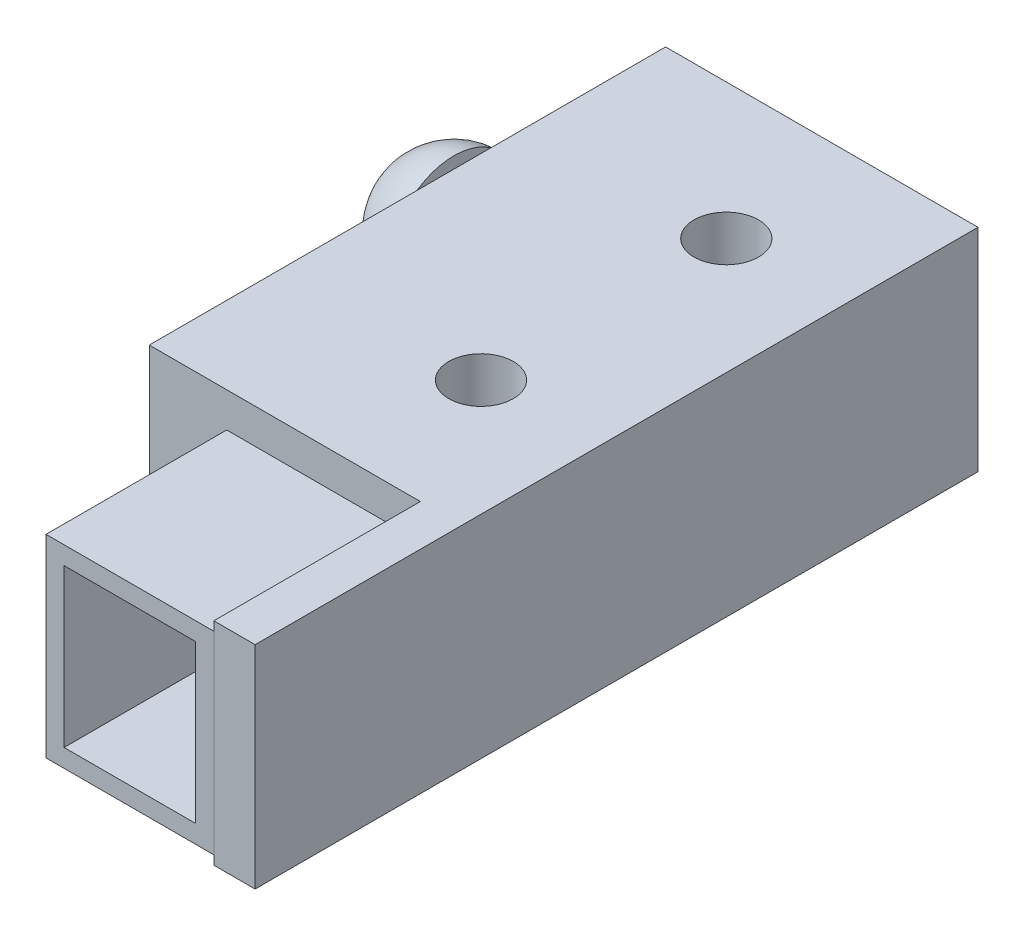
from build123d import *

# Parameters (mm, degrees)
SKETCH_1_W      = 10.5
SKETCH_1_H      = 20
SKETCH_1_R      = 1.25
EXTRUDE_1_DEPTH = 6.5
SKETCH_2_W      = 2
SKETCH_2_H      = 3.5
EXTRUDE_2_DEPTH = 1.2
SKETCH_3_R      = 2.5
EXTRUDE_3_DEPTH = 2.5
FILLET_1_R      = 2.5
SKETCH_4_W      = 28
SKETCH_4_H      = 8.2
EXTRUDE_4_DEPTH = 1.6
SKETCH_5_W      = 7
SKETCH_5_H      = 7.5
EXTRUDE_5_DEPTH = 6.5
SHELL_1_T       = -0.7


with BuildPart() as part:
    # 草图1 → 凸台-拉伸1 (new body)
    with BuildSketch(Plane(origin=(0, 0, 0), x_dir=(1, 0, 0), z_dir=(0, 1, 0))):
        with Locations((-2.35, 0)):
            Rectangle(SKETCH_1_W, SKETCH_1_H)
        with Locations(Location((0, 4.75, 0), (0, 0, 90))):
            Circle(SKETCH_1_R, mode=Mode.SUBTRACT)
        with Locations(Location((0, -4.75, 0), (0, 0, 90))):
            Circle(SKETCH_1_R, mode=Mode.SUBTRACT)
    extrude(amount=EXTRUDE_1_DEPTH)

    # 草图2 → 凸台-拉伸2 (add)
    with BuildSketch(Plane.ZY.offset(7.6)):
        with Locations((-3, 3.25)):
            Rectangle(SKETCH_2_W, SKETCH_2_H)
    extrude(amount=EXTRUDE_2_DEPTH)

    # 草图3 → 凸台-拉伸3 (add)
    with BuildSketch(Plane.ZY.offset(8.8)):
        with Locations((-3, 3.25)):
            Circle(SKETCH_3_R)
    extrude(amount=EXTRUDE_3_DEPTH)

    # 圆角1
    fillet_1_edges = [part.edges().sort_by_distance(p)[0] for p in [
        (-11.3, 3.25, -5.5),
    ]]
    fillet(fillet_1_edges, radius=FILLET_1_R - 0.0001)  # a hair under: the kernel refuses the full size

    # 草图4 → 凸台-拉伸4 (add)
    with BuildSketch(Plane(origin=(2.9, 0, 0), x_dir=(0, 0, -1), z_dir=(1, 0, 0))):
        with Locations((-4, 2.4)):
            Rectangle(SKETCH_4_W, SKETCH_4_H)
    extrude(amount=EXTRUDE_4_DEPTH)


with BuildPart() as body_2:
    # 草图5 → 凸台-拉伸5 (new body)
    with BuildSketch(Plane.ZY.offset(-2.9)):
        with Locations((14.5, 2.4)):
            Rectangle(SKETCH_5_W, SKETCH_5_H)
    extrude(amount=EXTRUDE_5_DEPTH)

    # 抽壳1
    shell_1_openings = [body_2.faces().sort_by_distance(p)[0] for p in [
        (-0.35, 2.4, 18),
    ]]
    offset(amount=SHELL_1_T, openings=shell_1_openings, kind=Kind.INTERSECTION)


solid = Compound([part.part, body_2.part])
